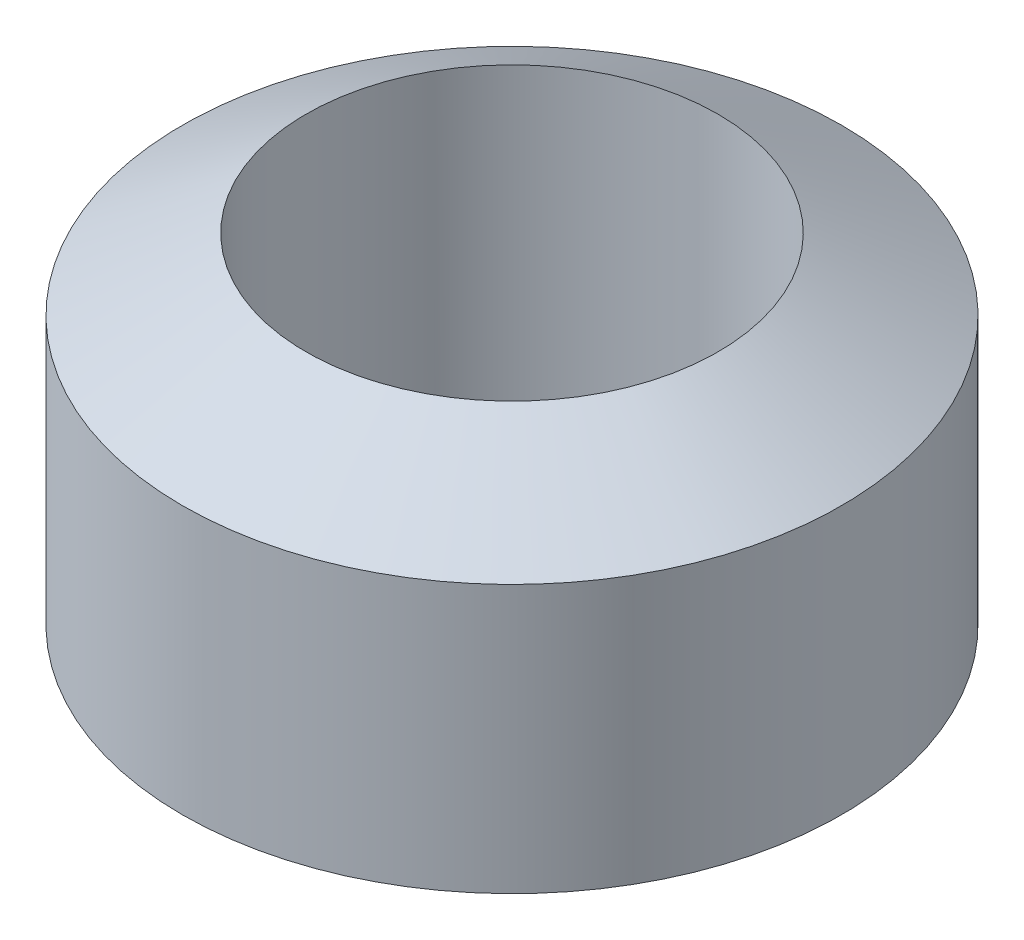
from build123d import *

# Parameters (mm, degrees)
SKETCH2_R           = 8
SKETCH2_R_2         = 5
BOSS_EXTRUDE1_DEPTH = 10
CHAMFER3_SIZE       = 1.75
CHAMFER3_SIZE_2     = 3.031088913
CHAMFER4_SIZE       = 1.75
CHAMFER4_SIZE_2     = 3.031088913


with BuildPart() as part:
    # Sketch2 → Boss-Extrude1 (new body)
    with BuildSketch(Plane(origin=(0, 0, 0), x_dir=(1, 0, 0), z_dir=(0, 1, 0))):
        with Locations(Location((0, 0, 0), (0, 0, 270))):
            Circle(SKETCH2_R)
        with Locations(Location((0, 0, 0), (0, 0, 270))):
            Circle(SKETCH2_R_2, mode=Mode.SUBTRACT)
    extrude(amount=BOSS_EXTRUDE1_DEPTH)

    # Chamfer3
    # the kernel refuses this chamfer: 3.031088913, 1.75 mm, written as the material it takes off along each edge
    with BuildSketch(Plane(origin=(0, 10, 0), x_dir=(0, 0, 1), z_dir=(-1, 0, 0))) as chamfer3_piece_1:
        Polygon((8, -CHAMFER3_SIZE), (8 - CHAMFER3_SIZE_2, 0), (8, 0), align=None)
    revolve(axis=Axis((0, 10, 0), (0, 1, 0)), mode=Mode.SUBTRACT)

    # Chamfer4
    # the kernel refuses this chamfer: 3.031088913, 1.75 mm, written as the material it takes off along each edge
    with BuildSketch(Plane(origin=(0, 0, 0), x_dir=(0, 0, 1), z_dir=(-1, 0, 0))) as chamfer4_piece_1:
        Polygon((8, CHAMFER4_SIZE), (8 - CHAMFER4_SIZE_2, 0), (8, 0), align=None)
    revolve(axis=Axis((0, 0, 0), (0, 1, 0)), mode=Mode.SUBTRACT)


solid = part.part
